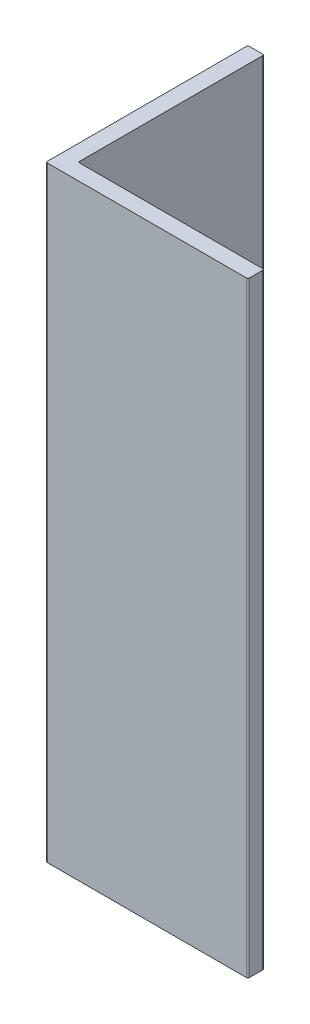
from build123d import *

# Parameters (mm, degrees)
DODANIE_WYCI_GNI_CIE1_DEPTH = 45
ZAOKR_GLENIE2_R             = 0.1


with BuildPart() as part:
    # Szkic1 → Dodanie-wyciągnięcie1 (new body)
    with BuildSketch(Plane(origin=(0, 0, 0), x_dir=(1, 0, 0), z_dir=(0, 1, 0))):
        Polygon((0, 0), (15, 0), (15, 1.2), (1.2, 1.2), (1.2, 15), (0, 15), align=None)
    extrude(amount=DODANIE_WYCI_GNI_CIE1_DEPTH)

    # Zaokrąglenie2
    zaokr_glenie2_edges = [part.edges().sort_by_distance(p)[0] for p in [
        (0, 22.5, -15),
        (1.2, 22.5, -1.2),
        (15, 22.5, -1.2),
        (15, 22.5, 0),
        (0, 22.5, 0),
        (1.2, 22.5, -15),
    ]]
    fillet(zaokr_glenie2_edges, radius=ZAOKR_GLENIE2_R)


solid = part.part
